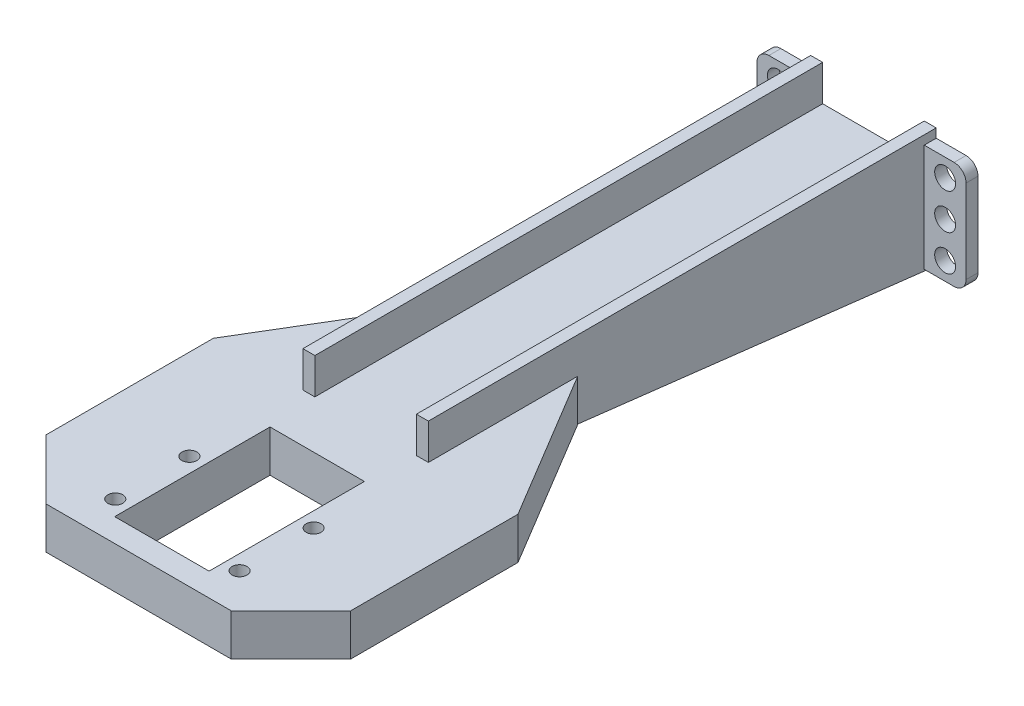
from build123d import *

# Parameters (mm, degrees)
ESQUISSE1_W                  = 35
ESQUISSE1_H                  = 35
BOSS_EXTRU_1_DEPTH           = 2
ESQUISSE2_R                  = 1.75
ESQUISSE2_W                  = 35
ESQUISSE2_H                  = 1.064971157
ENL_V_MAT_EXTRU_1_DEPTH      = 2
BOSS_EXTRU_2_DEPTH           = 280
ESQUISSE5_W                  = 7
ESQUISSE5_H                  = 6
ESQUISSE5_R                  = 1.75
BOSS_EXTRU_3_DEPTH           = 2
ESQUISSE6_R                  = 1.75
BOSS_EXTRU_4_DEPTH           = 2
ESQUISSE10_W                 = 35
ESQUISSE10_H                 = 33.935028843
ESQUISSE10_R                 = 1.75
BOSS_EXTRU_5_DEPTH           = 2
ESQUISSE15_R                 = 6.5
ESQUISSE15_R_2               = 1.75
ENL_V_MAT_EXTRU_2_DEPTH      = 373
CONG_1_R                     = 2
CONG_2_R                     = 4
EXTRU_MINCE1_START           = -2
EXTRU_MINCE1_OUTLINE_W       = 35
EXTRU_MINCE1_OUTLINE_H       = 10
EXTRU_MINCE1_DEPTH           = 2
BOSS_EXTRU_7_DEPTH           = 62.5
BOSS_EXTRU_8_DEPTH           = 160
ENL_V_MAT_EXTRU_4_DEPTH      = 15
BOSS_EXTRU_31_DEPTH          = 69.5
BOSS_EXTRU_31_DEPTH_BACK     = 90.5
ESQUISSE29_W                 = 0.210775501
ESQUISSE29_H                 = 2
BOSS_EXTRU_32_DEPTH          = 160
ENL_V_MAT_EXTRU_7_DEPTH      = 10
ENL_V_MAT_EXTRU_7_DEPTH_BACK = 5
ESQUISSE34_W                 = 144
ESQUISSE34_H                 = 64.710678118
ENL_V_MAT_EXTRU_8_DEPTH      = 2
ESQUISSE35_R                 = 1.5
BOSS_EXTRU_35_DEPTH          = 2
BOSS_EXTRU_36_START          = -2
ESQUISSE36_R                 = 1.5
BOSS_EXTRU_36_DEPTH          = 2
BOSS_EXTRU_37_DEPTH          = 21
BOSS_EXTRU_38_DEPTH          = 28
ESQUISSE42_W                 = 17
ESQUISSE42_H                 = 6
ENL_V_MAT_EXTRU_9_DEPTH      = 124
ESQUISSE43_R                 = 1.1
ENL_V_MAT_EXTRU_11_DEPTH     = 50
ESQUISSE45_R                 = 1.5
ENL_V_MAT_EXTRU_12_DEPTH     = 50
ESQUISSE47_R                 = 1.75
BOSS_EXTRU_40_DEPTH          = 2
ENL_V_MAT_EXTRU_13_DEPTH     = 2
ESQUISSE49_R                 = 1.75
BOSS_EXTRU_41_DEPTH          = 2
ESQUISSE50_W                 = 12.927363302
ESQUISSE50_H                 = 18
ENL_V_MAT_EXTRU_14_DEPTH     = 2
ESQUISSE51_R                 = 1.75
BOSS_EXTRU_42_DEPTH          = 2
BOSS_EXTRU_43_DEPTH          = 2
BOSS_EXTRU_43_DEPTH_BACK     = 2
ESQUISSE53_R                 = 1.75
ENL_V_START                  = -2
ESQUISSE54_R                 = 1.75
ENL_V_MAT_EXTRU_15_DEPTH     = 2
BOSS_EXTRU_44_DEPTH          = 2
BOSS_EXTRU_44_DEPTH_BACK     = 2
ESQUISSE55_R                 = 1.75
ESQUISSE56_R                 = 1.75
ESQUISSE56_R_2               = 6.5
ENL_V_MAT_EXTRU_16_DEPTH     = 305
ESQUISSE57_W                 = 160
ESQUISSE57_H                 = 70.710678119
ENL_V_MAT_EXTRU_17_DEPTH     = 305
BOSS_EXTRU_46_DEPTH          = 2
BOSS_EXTRU_46_DEPTH_BACK     = 5
ESQUISSE60_R                 = 1.1
ESQUISSE61_R                 = 1.25
ENL_V_MAT_EXTRU_18_DEPTH     = 10
BOSS_EXTRU_47_START          = -7
ESQUISSE64_R                 = 1.1
BOSS_EXTRU_47_DEPTH          = 7


# Read off the part's stored shape, not the designer's step: Extru.-Mince1
with BuildPart() as part:
    # Esquisse1 → Boss.-Extru.1 (new body)
    with BuildSketch(Plane(origin=(0, 0, 0), x_dir=(1, 0, 0), z_dir=(0, 1, 0))):
        with Locations((17.5, -17.5)):
            Rectangle(ESQUISSE1_W, ESQUISSE1_H)
    extrude(amount=BOSS_EXTRU_1_DEPTH)

    # Esquisse2 → Enlèv. mat.-Extru.1 (cut)
    with BuildSketch(Plane(origin=(0, 2, 0), x_dir=(1, 0, 0), z_dir=(0, 1, 0))):
        with Locations(Location((30.935029054, -4.064971369, 0), (0, 0, 270))):
            Circle(ESQUISSE2_R)
        with Locations(Location((30.935028843, -30.935028843, 0), (0, 0, 270))):
            Circle(ESQUISSE2_R)
        with Locations(Location((4.064971369, -4.064970946, 0), (0, 0, 270))):
            Circle(ESQUISSE2_R)
        with Locations(Location((4.064971157, -30.935028843, 0), (0, 0, 270))):
            Circle(ESQUISSE2_R)
        with Locations((17.5, -34.467514421)):
            Rectangle(ESQUISSE2_W, ESQUISSE2_H)
    extrude(amount=-ENL_V_MAT_EXTRU_1_DEPTH, mode=Mode.SUBTRACT)

    # Esquisse4 → Boss.-Extru.2 (add)
    with BuildSketch(Plane(origin=(0, 2, 0), x_dir=(1, 0, 0), z_dir=(0, 1, 0))):
        Polygon((17.5, -33.935028843), (7, -33.935028843), (7, -4.064970946), (28, -4.064970946), (28, -33.935028843), align=None)
    extrude(amount=BOSS_EXTRU_2_DEPTH)

    # Esquisse5 → Boss.-Extru.3 (add)
    # profile 1 of 4: a face of its own
    with BuildSketch(Plane.XY.offset(33.935028843)):
        with Locations((31.5, 254)):
            Rectangle(ESQUISSE5_W, ESQUISSE5_H)
        with Locations((31.5, 254)):
            Circle(ESQUISSE5_R, mode=Mode.SUBTRACT)
    # profile 2 of 4: a face of its own
    with BuildSketch(Plane.XY.offset(33.935028843)):
        with Locations((3.5, 254)):
            Rectangle(ESQUISSE5_W, ESQUISSE5_H)
        with Locations((3.5, 254)):
            Circle(ESQUISSE5_R, mode=Mode.SUBTRACT)
    # profile 3 of 4: a face of its own
    with BuildSketch(Plane.XY.offset(33.935028843)):
        with Locations((31.5, 28)):
            Rectangle(ESQUISSE5_W, ESQUISSE5_H)
        with Locations((31.5, 28)):
            Circle(ESQUISSE5_R, mode=Mode.SUBTRACT)
    # profile 4 of 4: a face of its own
    with BuildSketch(Plane.XY.offset(33.935028843)):
        with Locations((3.5, 28)):
            Rectangle(ESQUISSE5_W, ESQUISSE5_H)
        with Locations((3.5, 28)):
            Circle(ESQUISSE5_R, mode=Mode.SUBTRACT)
    extrude(amount=-BOSS_EXTRU_3_DEPTH)

    # Esquisse6 → Boss.-Extru.4 (add)
    # profile 1 of 2: a face of its own
    with BuildSketch(Plane.XY.offset(33.935028843)):
        Polygon((7, 144), (0, 144), (0, 141), (0, 138), (7, 138), (7, 141), align=None)
        with Locations((3.5, 141)):
            Circle(ESQUISSE6_R, mode=Mode.SUBTRACT)
    # profile 2 of 2: a face of its own
    with BuildSketch(Plane.XY.offset(33.935028843)):
        Polygon((35, 144), (28, 144), (28, 141), (28, 138), (35, 138), (35, 141), align=None)
        with Locations((31.5, 141)):
            Circle(ESQUISSE6_R, mode=Mode.SUBTRACT)
    extrude(amount=-BOSS_EXTRU_4_DEPTH)

    # Esquisse10 → Boss.-Extru.5 (add)
    with BuildSketch(Plane(origin=(0, 282, 0), x_dir=(1, 0, 0), z_dir=(0, 1, 0))):
        with Locations((17.5, -16.967514422)):
            Rectangle(ESQUISSE10_W, ESQUISSE10_H)
        with Locations(Location((30.935028843, -30.935028843, 0), (0, 0, 270))):
            Circle(ESQUISSE10_R, mode=Mode.SUBTRACT)
        with Locations(Location((30.935028631, -4.064970946, 0), (0, 0, 270.000013863))):
            Circle(ESQUISSE10_R, mode=Mode.SUBTRACT)
        with Locations(Location((4.064970946, -4.064971369, 0), (0, 0, 270.000013863))):
            Circle(ESQUISSE10_R, mode=Mode.SUBTRACT)
        with Locations(Location((4.064971157, -30.935028843, 0), (0, 0, 270))):
            Circle(ESQUISSE10_R, mode=Mode.SUBTRACT)
    extrude(amount=-BOSS_EXTRU_5_DEPTH)

    # Esquisse15 → Enlèv. mat.-Extru.2 (cut)
    with BuildSketch(Plane(origin=(0, 282, 0), x_dir=(1, 0, 0), z_dir=(0, 1, 0))):
        with Locations(Location((17.5, -17.5, 0), (0, 0, 270))):
            Circle(ESQUISSE15_R)
        with Locations(Location((30.935029054, -4.064971369, 0), (0, 0, 270))):
            Circle(ESQUISSE15_R_2)
    extrude(amount=-ENL_V_MAT_EXTRU_2_DEPTH, mode=Mode.SUBTRACT)

    # Congé1
    cong_1_edges = [part.edges().sort_by_distance(p)[0] for p in [
        (0, 31, 32.935028843),
        (0, 25, 32.935028843),
        (0, 144, 32.935028843),
        (0, 138, 32.935028843),
        (35, 144, 32.935028843),
        (35, 138, 32.935028843),
        (35, 257, 32.935028843),
        (35, 251, 32.935028843),
        (0, 251, 32.935028843),
        (0, 257, 32.935028843),
        (35, 31, 32.935028843),
        (35, 25, 32.935028843),
    ]]
    fillet(cong_1_edges, radius=CONG_1_R)

    # Congé2
    cong_2_edges = [part.edges().sort_by_distance(p)[0] for p in [
        (35, 281, 0),
        (0, 281, 0),
        (0, 1, 0),
        (35, 1, 0),
    ]]
    fillet(cong_2_edges, radius=CONG_2_R)

    # Extru.-Mince1 outline → Extru.-Mince1 (add)
    with BuildSketch(Plane(origin=(0, 282, 0), x_dir=(1, 0, 0), z_dir=(0, 1, 0)).offset(EXTRU_MINCE1_START)):
        with Locations((17.5, -38.935028843)):
            Rectangle(EXTRU_MINCE1_OUTLINE_W, EXTRU_MINCE1_OUTLINE_H)
    extrude(amount=EXTRU_MINCE1_DEPTH)

    # Esquisse20 → Boss.-Extru.7 (add)
    with BuildSketch(Plane.ZY):
        Polygon((43.935028843, 282), (114.645706961, 211.289321881), (110.645706961, 211.289321881), (41.935028843, 280), (34.145804344, 280), (34.145804344, 282), align=None)
    extrude(amount=BOSS_EXTRU_7_DEPTH)

    # Esquisse21 → Boss.-Extru.8 (add)
    with BuildSketch(Plane.ZY.offset(62.5)):
        Polygon((34.145804344, 280), (41.935028843, 280), (110.645706961, 211.289321881), (114.645706961, 211.289321881), (43.935028843, 282), (34.145804344, 282), align=None)
    extrude(amount=-BOSS_EXTRU_8_DEPTH)

    # Esquisse22 → Enlèv. mat.-Extru.4 (cut)
    with BuildSketch(Plane(origin=(0, 162.967514421, 162.967514421), x_dir=(1, 0, 0), z_dir=(0, 0.7071067811865462, 0.7071067811865488))):
        Polygon((-42.064466094, 147.626821562), (-45.6, 147.626821562), (-45.6, 89.047889374), (-42.064466094, 89.047889374), (-42.064466094, 85.512355468), (77.064466094, 85.512355468), (77.064466094, 89.047889374), (80.6, 89.047889374), (80.6, 147.626821562), (77.064466094, 147.626821562), (77.064466094, 151.162355468), (-42.064466094, 151.162355468), align=None)
    extrude(amount=-ENL_V_MAT_EXTRU_4_DEPTH, mode=Mode.SUBTRACT)

    # Esquisse29 → Boss.-Extru.31 (add, two sides: drawn at the far end of the back side and taken through both)
    with BuildSketch(Plane.ZY.offset(-7).offset(-BOSS_EXTRU_31_DEPTH_BACK)):
        with Locations((34.040416594, 281)):
            Rectangle(ESQUISSE29_W, ESQUISSE29_H)
    extrude(amount=BOSS_EXTRU_31_DEPTH + BOSS_EXTRU_31_DEPTH_BACK)

    # Esquisse32 → Boss.-Extru.32 (add)
    with BuildSketch(Plane.ZY.offset(62.5)):
        Polygon((110.645706961, 211.289321881), (33.935028843, 211.289321881), (33.935028843, 280), (35.935028843, 280), (35.935028843, 213.289321881), (108.645706961, 213.289321881), align=None)
    extrude(amount=-BOSS_EXTRU_32_DEPTH)

    # Esquisse33 → Enlèv. mat.-Extru.7 (cut, two sides: drawn at the far end of the back side and taken through both)
    with BuildSketch(Plane(origin=(0, 0, 33.935028843), x_dir=(-1, 0, 0), z_dir=(0, 0, -1)).offset(-ENL_V_MAT_EXTRU_7_DEPTH_BACK)):
        Polygon((-28, 274.000000001), (-89.5, 274.000000001), (-89.5, 219.289321881), (-81.5, 219.289321881), (-28, 219.289321881), align=None)
        with BuildLine():
            Line((54.5, 274.000000001), (-7, 274.000000001))
            Line((-7, 274.000000001), (-7, 257))
            Line((-7, 257), (-2, 257))
            ThreePointArc((-2, 257), (-0.585786438, 256.414213562), (0, 255))
            Line((0, 255), (0, 253))
            ThreePointArc((0, 253), (-0.585786438, 251.585786438), (-2, 251))
            Line((-2, 251), (-7, 251))
            Line((-7, 251), (-7, 219.289321881))
            Line((-7, 219.289321881), (1, 219.289321881))
            Line((1, 219.289321881), (54.5, 219.289321881))
            Line((54.5, 219.289321881), (54.5, 274.000000001))
        make_face()
        with BuildLine():
            Line((-2, 257), (-7, 257))
            Line((-7, 257), (-7, 251))
            Line((-7, 251), (-2, 251))
            ThreePointArc((-2, 251), (-0.585786438, 251.585786438), (0, 253))
            Line((0, 253), (0, 255))
            ThreePointArc((0, 255), (-0.585786438, 256.414213562), (-2, 257))
        make_face()
    extrude(amount=ENL_V_MAT_EXTRU_7_DEPTH + ENL_V_MAT_EXTRU_7_DEPTH_BACK, mode=Mode.SUBTRACT)

    # Esquisse34 → Enlèv. mat.-Extru.8 (cut)
    with BuildSketch(Plane.XZ.offset(-211.289321881)):
        with Locations((17.5, 74.290367902)):
            Rectangle(ESQUISSE34_W, ESQUISSE34_H)
    extrude(amount=-ENL_V_MAT_EXTRU_8_DEPTH, mode=Mode.SUBTRACT)

    # Esquisse35 → Boss.-Extru.35 (add)
    with BuildSketch(Plane(origin=(97.5, 0, 0), x_dir=(0, 0, -1), z_dir=(1, 0, 0))):
        Polygon((-35.935028843, 280), (-35.935028843, 274.000000001), (-35.935028843, 213.289321881), (-108.645706961, 213.289321881), (-102.645706961, 219.289321881), (-41.935028842, 219.289321881), (-41.935028842, 274.000000001), (-47.935028841, 274.000000001), (-41.935028843, 280), align=None)
        with Locations((-38.935028842, 216.289321881)):
            Circle(ESQUISSE35_R, mode=Mode.SUBTRACT)
        with Locations((-38.935028842, 277.000000001)):
            Circle(ESQUISSE35_R, mode=Mode.SUBTRACT)
        with Locations((-99.645706961, 216.289321881)):
            Circle(ESQUISSE35_R, mode=Mode.SUBTRACT)
    extrude(amount=-BOSS_EXTRU_35_DEPTH)

    # Esquisse36 → Boss.-Extru.36 (add)
    with BuildSketch(Plane.ZY.offset(62.5).offset(BOSS_EXTRU_36_START)):
        Polygon((35.935028843, 213.289321881), (108.645706961, 213.289321881), (102.645706961, 219.289321881), (41.935028842, 219.289321881), (41.935028842, 274.000000001), (47.935028841, 274.000000001), (41.935028843, 280), (35.935028843, 280), (35.935028843, 274.000000001), align=None)
        with Locations(Location((99.645706961, 216.289321881, 0), (0, 0, 180))):
            Circle(ESQUISSE36_R, mode=Mode.SUBTRACT)
        with Locations(Location((38.935028842, 277.000000001, 0), (0, 0, 180))):
            Circle(ESQUISSE36_R, mode=Mode.SUBTRACT)
        with Locations(Location((38.935028842, 216.289321881, 0), (0, 0, 180))):
            Circle(ESQUISSE36_R, mode=Mode.SUBTRACT)
    extrude(amount=BOSS_EXTRU_36_DEPTH)

    # Esquisse39 → Boss.-Extru.37 (add)
    with BuildSketch(Plane(origin=(28, 0, 0), x_dir=(0, 0, -1), z_dir=(1, 0, 0))):
        Polygon((-33.935028843, 211.289321881), (-33.935028843, 191.289321881), (-118.935028843, 201.289321881), (-118.935028843, 211.289321881), align=None)
    extrude(amount=-BOSS_EXTRU_37_DEPTH)

    # Esquisse40 → Boss.-Extru.38 (add)
    with BuildSketch(Plane.XY.offset(118.935028843)):
        Polygon((7, 201.289321881), (2, 201.289321881), (2, 203.289321881), (33, 203.289321881), (33, 201.289321881), (28, 201.289321881), align=None)
    extrude(amount=BOSS_EXTRU_38_DEPTH)

    # Esquisse42 → Enlèv. mat.-Extru.9 (cut)
    with BuildSketch(Plane.XY.offset(118.935028843)):
        with Locations((17.5, 208.289321881)):
            Rectangle(ESQUISSE42_W, ESQUISSE42_H)
    extrude(amount=-ENL_V_MAT_EXTRU_9_DEPTH, mode=Mode.SUBTRACT)

    # Esquisse43 → Enlèv. mat.-Extru.11 (cut)
    with BuildSketch(Plane(origin=(0, 203.289321881, 0), x_dir=(1, 0, 0), z_dir=(0, 1, 0))):
        with Locations(Location((5, -144.935028843, 0), (0, 0, 270))):
            Circle(ESQUISSE43_R)
        with Locations(Location((30, -144.935028843, 0), (0, 0, 270))):
            Circle(ESQUISSE43_R)
        with Locations(Location((5, -130.435028843, 0), (0, 0, 270))):
            Circle(ESQUISSE43_R)
        with Locations(Location((30, -130.435028843, 0), (0, 0, 270))):
            Circle(ESQUISSE43_R)
        with BuildLine():
            Line((5, -123.319506434), (5, -128.435028843))
            ThreePointArc((5, -128.435028843), (7, -130.435028843), (5, -132.435028843))
            Line((5, -132.435028843), (5, -142.935028843))
            ThreePointArc((5, -142.935028843), (6.414213562, -143.52081528), (7, -144.935028843))
            Line((7, -144.935028843), (28, -144.935028843))
            ThreePointArc((28, -144.935028843), (28.585786438, -143.52081528), (30, -142.935028843))
            Line((30, -142.935028843), (30, -132.435028843))
            ThreePointArc((30, -132.435028843), (28, -130.435028843), (30, -128.435028843))
            Line((30, -128.435028843), (30, -123.319506434))
            Line((30, -123.319506434), (5, -123.319506434))
        make_face()
    extrude(amount=-ENL_V_MAT_EXTRU_11_DEPTH, mode=Mode.SUBTRACT)

    # Esquisse45 → Enlèv. mat.-Extru.12 (cut)
    with BuildSketch(Plane(origin=(0, 162.967514421, 162.967514421), x_dir=(1, 0, 0), z_dir=(0, 0.7071067811865462, 0.7071067811865488))):
        with Locations(Location((80.6, 151.162355468, 0), (0, 0, 270))):
            Circle(ESQUISSE45_R)
        with Locations(Location((80.6, 85.512355468, 0), (0, 0, 270))):
            Circle(ESQUISSE45_R)
        with Locations(Location((-45.6, 85.512355468, 0), (0, 0, 270))):
            Circle(ESQUISSE45_R)
        with Locations(Location((-45.6, 151.162355468, 0), (0, 0, 270))):
            Circle(ESQUISSE45_R)
    extrude(amount=-ENL_V_MAT_EXTRU_12_DEPTH, mode=Mode.SUBTRACT)

    # Esquisse47 → Boss.-Extru.40 (add)
    # profile 1 of 4: a face of its own
    with BuildSketch(Plane.XY.offset(33.935028843)):
        with BuildLine():
            Line((2, 144), (7, 144))
            Line((7, 144), (7, 150))
            Line((7, 150), (2, 150))
            ThreePointArc((2, 150), (0.585786438, 149.414213562), (0, 148))
            Line((0, 148), (0, 146))
            ThreePointArc((0, 146), (0.585786438, 144.585786438), (2, 144))
        make_face()
        with Locations((3.5, 147)):
            Circle(ESQUISSE47_R, mode=Mode.SUBTRACT)
    # profile 2 of 4: a face of its own
    with BuildSketch(Plane.XY.offset(33.935028843)):
        with BuildLine():
            Line((28, 150), (28, 144))
            Line((28, 144), (33, 144))
            ThreePointArc((33, 144), (34.414213562, 144.585786438), (35, 146))
            Line((35, 146), (35, 148))
            ThreePointArc((35, 148), (34.414213562, 149.414213562), (33, 150))
            Line((33, 150), (28, 150))
        make_face()
        with Locations((31.5, 147)):
            Circle(ESQUISSE47_R, mode=Mode.SUBTRACT)
    # profile 3 of 4: a face of its own
    with BuildSketch(Plane.XY.offset(33.935028843)):
        with BuildLine():
            Line((35, 134), (35, 136))
            ThreePointArc((35, 136), (34.414213562, 137.414213562), (33, 138))
            Line((33, 138), (28, 138))
            Line((28, 138), (28, 132))
            Line((28, 132), (33, 132))
            ThreePointArc((33, 132), (34.414213562, 132.585786438), (35, 134))
        make_face()
        with Locations((31.5, 135)):
            Circle(ESQUISSE47_R, mode=Mode.SUBTRACT)
    # profile 4 of 4: a face of its own
    with BuildSketch(Plane.XY.offset(33.935028843)):
        with BuildLine():
            Line((7, 138), (2, 138))
            ThreePointArc((2, 138), (0.585786438, 137.414213562), (0, 136))
            Line((0, 136), (0, 134))
            ThreePointArc((0, 134), (0.585786438, 132.585786438), (2, 132))
            Line((2, 132), (7, 132))
            Line((7, 132), (7, 138))
        make_face()
        with Locations((3.5, 135)):
            Circle(ESQUISSE47_R, mode=Mode.SUBTRACT)
    extrude(amount=-BOSS_EXTRU_40_DEPTH)

    # Esquisse48 → Enlèv. mat.-Extru.13 (cut)
    with BuildSketch(Plane.XY.offset(33.935028843)):
        Polygon((-4.556540033, 144), (-4.556540033, 138), (2, 138), (7, 138), (7, 144), (2, 144), align=None)
        Polygon((33.295178048, 144), (39.851718081, 144), (39.851718081, 138), (33.295178048, 138), (28.295178048, 138), (28.295178048, 144), align=None)
    extrude(amount=-ENL_V_MAT_EXTRU_13_DEPTH, mode=Mode.SUBTRACT)

    # Esquisse49 → Boss.-Extru.41 (add)
    # profile 1 of 2: a face of its own
    with BuildSketch(Plane.XY.offset(33.935028843)):
        with BuildLine():
            Line((2, 180.289321881), (7, 180.289321881))
            Line((7, 180.289321881), (7, 186.289321881))
            Line((7, 186.289321881), (2, 186.289321881))
            ThreePointArc((2, 186.289321881), (0.585786438, 185.703535444), (0, 184.289321881))
            Line((0, 184.289321881), (0, 182.289321881))
            ThreePointArc((0, 182.289321881), (0.585786438, 180.875108319), (2, 180.289321881))
        make_face()
        with Locations((3.5, 183.289321881)):
            Circle(ESQUISSE49_R, mode=Mode.SUBTRACT)
    # profile 2 of 2: a face of its own
    with BuildSketch(Plane.XY.offset(33.935028843)):
        with BuildLine():
            Line((35, 182.289321881), (35, 184.289321881))
            ThreePointArc((35, 184.289321881), (34.414213562, 185.703535444), (33, 186.289321881))
            Line((33, 186.289321881), (28, 186.289321881))
            Line((28, 186.289321881), (28, 180.289321881))
            Line((28, 180.289321881), (33, 180.289321881))
            ThreePointArc((33, 180.289321881), (34.414213562, 180.875108319), (35, 182.289321881))
        make_face()
        with Locations((31.5, 183.289321881)):
            Circle(ESQUISSE49_R, mode=Mode.SUBTRACT)
    extrude(amount=-BOSS_EXTRU_41_DEPTH)

    # Esquisse50 → Enlèv. mat.-Extru.14 (cut)
    with BuildSketch(Plane.XY.offset(33.935028843)):
        with Locations((34.463681651, 141)):
            Rectangle(ESQUISSE50_W, ESQUISSE50_H)
    extrude(amount=-ENL_V_MAT_EXTRU_14_DEPTH, mode=Mode.SUBTRACT)

    # Esquisse51 → Boss.-Extru.42 (add)
    # profile 1 of 3: a face of its own
    with BuildSketch(Plane.XY.offset(33.935028843)):
        with BuildLine():
            Line((7, 150), (7, 144))
            Line((7, 144), (2, 144))
            ThreePointArc((2, 144), (0.585786438, 144.585786438), (0, 146))
            Line((0, 146), (0, 148))
            ThreePointArc((0, 148), (0.585786438, 149.414213562), (2, 150))
            Line((2, 150), (7, 150))
        make_face()
        with Locations((3.5, 147)):
            Circle(ESQUISSE51_R, mode=Mode.SUBTRACT)
    # profile 2 of 3: a face of its own
    with BuildSketch(Plane.XY.offset(33.935028843)):
        with BuildLine():
            Line((33, 138.018442997), (28, 138.018442997))
            Line((28, 138.018442997), (28, 132.018442997))
            Line((28, 132.018442997), (33, 132.018442997))
            ThreePointArc((33, 132.018442997), (34.414213562, 132.604229434), (35, 134.018442997))
            Line((35, 134.018442997), (35, 136.018442997))
            ThreePointArc((35, 136.018442997), (34.414213562, 137.432656559), (33, 138.018442997))
        make_face()
        with Locations((31.5, 135.018442997)):
            Circle(ESQUISSE51_R, mode=Mode.SUBTRACT)
    # profile 3 of 3: a face of its own
    with BuildSketch(Plane.XY.offset(33.935028843)):
        with BuildLine():
            Line((33, 150), (28, 150))
            Line((28, 150), (28, 144))
            Line((28, 144), (33, 144))
            ThreePointArc((33, 144), (34.414213562, 144.585786438), (35, 146))
            Line((35, 146), (35, 148))
            ThreePointArc((35, 148), (34.414213562, 149.414213562), (33, 150))
        make_face()
        with Locations((31.5, 147)):
            Circle(ESQUISSE51_R, mode=Mode.SUBTRACT)
    extrude(amount=-BOSS_EXTRU_42_DEPTH)

    # Esquisse53 → Boss.-Extru.43 (add, two sides: drawn at the far end of the back side and taken through both)
    # profile 1 of 4: a face of its own
    with BuildSketch(Plane(origin=(0, 0, 33.935028843), x_dir=(-1, 0, 0), z_dir=(0, 0, -1)).offset(-BOSS_EXTRU_43_DEPTH_BACK)):
        with BuildLine():
            Line((0, 275.000000001), (0, 273.000000001))
            ThreePointArc((0, 273.000000001), (-0.585786438, 271.585786439), (-2, 271.000000001))
            Line((-2, 271.000000001), (-7, 271.000000001))
            Line((-7, 271.000000001), (-7, 277.000000001))
            Line((-7, 277.000000001), (-2, 277.000000001))
            ThreePointArc((-2, 277.000000001), (-0.585786438, 276.414213564), (0, 275.000000001))
        make_face()
        with Locations(Location((-3.5, 274.000000001, 0), (0, 0, 180))):
            Circle(ESQUISSE53_R, mode=Mode.SUBTRACT)
    # profile 2 of 4: a face of its own
    with BuildSketch(Plane(origin=(0, 0, 33.935028843), x_dir=(-1, 0, 0), z_dir=(0, 0, -1)).offset(-BOSS_EXTRU_43_DEPTH_BACK)):
        with BuildLine():
            Line((-28, 222.289321881), (-28, 216.289321881))
            Line((-28, 216.289321881), (-33, 216.289321881))
            ThreePointArc((-33, 216.289321881), (-34.414213562, 216.875108319), (-35, 218.289321881))
            Line((-35, 218.289321881), (-35, 220.289321881))
            ThreePointArc((-35, 220.289321881), (-34.414213562, 221.703535444), (-33, 222.289321881))
            Line((-33, 222.289321881), (-28, 222.289321881))
        make_face()
        with Locations((-31.5, 219.289321881)):
            Circle(ESQUISSE53_R, mode=Mode.SUBTRACT)
    # profile 3 of 4: a face of its own
    with BuildSketch(Plane(origin=(0, 0, 33.935028843), x_dir=(-1, 0, 0), z_dir=(0, 0, -1)).offset(-BOSS_EXTRU_43_DEPTH_BACK)):
        with BuildLine():
            Line((-28, 277.000000001), (-28, 271.000000001))
            Line((-28, 271.000000001), (-33, 271.000000001))
            ThreePointArc((-33, 271.000000001), (-34.414213562, 271.585786439), (-35, 273.000000001))
            Line((-35, 273.000000001), (-35, 275.000000001))
            ThreePointArc((-35, 275.000000001), (-34.414213562, 276.414213564), (-33, 277.000000001))
            Line((-33, 277.000000001), (-28, 277.000000001))
        make_face()
        with Locations((-31.5, 274.000000001)):
            Circle(ESQUISSE53_R, mode=Mode.SUBTRACT)
    # profile 4 of 4: a face of its own
    with BuildSketch(Plane(origin=(0, 0, 33.935028843), x_dir=(-1, 0, 0), z_dir=(0, 0, -1)).offset(-BOSS_EXTRU_43_DEPTH_BACK)):
        with BuildLine():
            Line((0, 220.289321881), (0, 218.289321881))
            ThreePointArc((0, 218.289321881), (-0.585786438, 216.875108319), (-2, 216.289321881))
            Line((-2, 216.289321881), (-7, 216.289321881))
            Line((-7, 216.289321881), (-7, 222.289321881))
            Line((-7, 222.289321881), (-2, 222.289321881))
            ThreePointArc((-2, 222.289321881), (-0.585786438, 221.703535444), (0, 220.289321881))
        make_face()
        with Locations(Location((-3.5, 219.289321881, 0), (0, 0, 180))):
            Circle(ESQUISSE53_R, mode=Mode.SUBTRACT)
    extrude(amount=BOSS_EXTRU_43_DEPTH + BOSS_EXTRU_43_DEPTH_BACK)

    # Esquisse54 → Enlèv. mat.-Extru.15 (cut)
    with BuildSketch(Plane(origin=(0, 0, 33.935028843), x_dir=(-1, 0, 0), z_dir=(0, 0, -1)).offset(ENL_V_START)):
        with Locations((-31.5, 274.000000001)):
            Circle(ESQUISSE54_R)
        with Locations(Location((-3.5, 274.000000001, 0), (0, 0, 180))):
            Circle(ESQUISSE54_R)
        with Locations((-31.5, 219.289321881)):
            Circle(ESQUISSE54_R)
        with Locations(Location((-3.5, 219.289321881, 0), (0, 0, 180))):
            Circle(ESQUISSE54_R)
    extrude(amount=ENL_V_MAT_EXTRU_15_DEPTH, mode=Mode.SUBTRACT)

    # Esquisse55 → Boss.-Extru.44 (add, two sides: drawn at the far end of the back side and taken through both)
    # profile 1 of 2: a face of its own
    with BuildSketch(Plane(origin=(0, 0, 33.935028843), x_dir=(-1, 0, 0), z_dir=(0, 0, -1)).offset(-BOSS_EXTRU_44_DEPTH_BACK)):
        with BuildLine():
            Line((0, 207.789321881), (0, 205.789321881))
            Line((0, 205.789321881), (0, 201.789321881))
            Line((0, 201.789321881), (0, 199.789321881))
            Line((0, 199.789321881), (0, 195.789321881))
            Line((0, 195.789321881), (0, 193.789321881))
            ThreePointArc((0, 193.789321881), (-0.585786438, 192.375108319), (-2, 191.789321881))
            Line((-2, 191.789321881), (-7, 191.789321881))
            Line((-7, 191.789321881), (-7, 197.789321881))
            Line((-7, 197.789321881), (-7, 203.789321881))
            Line((-7, 203.789321881), (-7, 209.789321881))
            Line((-7, 209.789321881), (-2, 209.789321881))
            ThreePointArc((-2, 209.789321881), (-0.585786438, 209.203535444), (0, 207.789321881))
        make_face()
        with Locations((-3.5, 206.789321881)):
            Circle(ESQUISSE55_R, mode=Mode.SUBTRACT)
        with Locations((-3.5, 194.789321881)):
            Circle(ESQUISSE55_R, mode=Mode.SUBTRACT)
        with Locations((-3.5, 200.789321881)):
            Circle(ESQUISSE55_R, mode=Mode.SUBTRACT)
    # profile 2 of 2: a face of its own
    with BuildSketch(Plane(origin=(0, 0, 33.935028843), x_dir=(-1, 0, 0), z_dir=(0, 0, -1)).offset(-BOSS_EXTRU_44_DEPTH_BACK)):
        with BuildLine():
            Line((-35, 195.789321881), (-35, 193.789321881))
            ThreePointArc((-35, 193.789321881), (-34.414213562, 192.375108319), (-33, 191.789321881))
            Line((-33, 191.789321881), (-28, 191.789321881))
            Line((-28, 191.789321881), (-28, 197.789321881))
            Line((-28, 197.789321881), (-28, 203.789321881))
            Line((-28, 203.789321881), (-28, 209.789321881))
            Line((-28, 209.789321881), (-33, 209.789321881))
            ThreePointArc((-33, 209.789321881), (-34.414213562, 209.203535444), (-35, 207.789321881))
            Line((-35, 207.789321881), (-35, 205.789321881))
            Line((-35, 205.789321881), (-35, 201.789321881))
            Line((-35, 201.789321881), (-35, 199.789321881))
            Line((-35, 199.789321881), (-35, 195.789321881))
        make_face()
        with Locations((-31.5, 194.789321881)):
            Circle(ESQUISSE55_R, mode=Mode.SUBTRACT)
        with Locations((-31.5, 206.789321881)):
            Circle(ESQUISSE55_R, mode=Mode.SUBTRACT)
        with Locations((-31.5, 200.789321881)):
            Circle(ESQUISSE55_R, mode=Mode.SUBTRACT)
    extrude(amount=BOSS_EXTRU_44_DEPTH + BOSS_EXTRU_44_DEPTH_BACK)

    # Esquisse56 → Enlèv. mat.-Extru.16 (cut)
    # profile 1 of 7: a face of its own
    with BuildSketch(Plane(origin=(0, 282, 0), x_dir=(1, 0, 0), z_dir=(0, 1, 0))):
        with BuildLine():
            Line((-62.5, -33.935028843), (0, -33.935028843))
            Line((0, -33.935028843), (0, -4))
            ThreePointArc((0, -4), (1.171572875, -1.171572875), (4, 0))
            Line((4, 0), (31, 0))
            ThreePointArc((31, 0), (33.828427125, -1.171572875), (35, -4))
            Line((35, -4), (35, -33.935028843))
            Line((35, -33.935028843), (97.5, -33.935028843))
            Line((97.5, -33.935028843), (137.880494562, -33.935028843))
            Line((137.880494562, -33.935028843), (137.880494562, 14.445563897))
            Line((137.880494562, 14.445563897), (-77.143975035, 14.445563897))
            Line((-77.143975035, 14.445563897), (-77.143975035, -33.935028843))
            Line((-77.143975035, -33.935028843), (-62.5, -33.935028843))
        make_face()
    # profile 2 of 7: a face of its own
    with BuildSketch(Plane(origin=(0, 282, 0), x_dir=(1, 0, 0), z_dir=(0, 1, 0))):
        with BuildLine():
            Line((0, -33.935028843), (1, -33.935028843))
            Line((1, -33.935028843), (35, -33.935028843))
            Line((35, -33.935028843), (35, -4))
            ThreePointArc((35, -4), (33.828427125, -1.171572875), (31, 0))
            Line((31, 0), (4, 0))
            ThreePointArc((4, 0), (1.171572875, -1.171572875), (0, -4))
            Line((0, -4), (0, -33.935028843))
        make_face()
        with Locations((4.064971157, -30.935028843)):
            Circle(ESQUISSE56_R, mode=Mode.SUBTRACT)
        with Locations((17.5, -17.5)):
            Circle(ESQUISSE56_R_2, mode=Mode.SUBTRACT)
        with Locations((30.935028843, -30.935028843)):
            Circle(ESQUISSE56_R, mode=Mode.SUBTRACT)
        with Locations((4.064970946, -4.064971369)):
            Circle(ESQUISSE56_R, mode=Mode.SUBTRACT)
        with Locations((30.935028631, -4.064970946)):
            Circle(ESQUISSE56_R, mode=Mode.SUBTRACT)
    # profile 3 of 7: a face of its own
    with BuildSketch(Plane(origin=(0, 282, 0), x_dir=(1, 0, 0), z_dir=(0, 1, 0))):
        with Locations((4.064970946, -4.064971369)):
            Circle(ESQUISSE56_R)
    # profile 4 of 7: a face of its own
    with BuildSketch(Plane(origin=(0, 282, 0), x_dir=(1, 0, 0), z_dir=(0, 1, 0))):
        with Locations((4.064971157, -30.935028843)):
            Circle(ESQUISSE56_R)
    # profile 5 of 7: a face of its own
    with BuildSketch(Plane(origin=(0, 282, 0), x_dir=(1, 0, 0), z_dir=(0, 1, 0))):
        with Locations((30.935028843, -30.935028843)):
            Circle(ESQUISSE56_R)
    # profile 6 of 7: a face of its own
    with BuildSketch(Plane(origin=(0, 282, 0), x_dir=(1, 0, 0), z_dir=(0, 1, 0))):
        with Locations((30.935028631, -4.064970946)):
            Circle(ESQUISSE56_R)
    # profile 7 of 7: a face of its own
    with BuildSketch(Plane(origin=(0, 282, 0), x_dir=(1, 0, 0), z_dir=(0, 1, 0))):
        with Locations((17.5, -17.5)):
            Circle(ESQUISSE56_R_2)
    extrude(amount=-ENL_V_MAT_EXTRU_16_DEPTH, mode=Mode.SUBTRACT)

    # Esquisse57 → Enlèv. mat.-Extru.17 (cut)
    with BuildSketch(Plane(origin=(0, 0, 33.935028843), x_dir=(-1, 0, 0), z_dir=(0, 0, -1))):
        with Locations((-17.5, 246.64466094)):
            Rectangle(ESQUISSE57_W, ESQUISSE57_H)
    extrude(amount=-ENL_V_MAT_EXTRU_17_DEPTH, mode=Mode.SUBTRACT)

    # Esquisse60 → Boss.-Extru.46 (add, two sides: drawn at the far end of the back side and taken through both)
    # profile 1 of 3: a face of its own
    with BuildSketch(Plane(origin=(0, 203.289321881, 0), x_dir=(1, 0, 0), z_dir=(0, 1, 0)).offset(-BOSS_EXTRU_46_DEPTH_BACK)):
        Polygon((28, -93.935028843), (17.5, -93.935028843), (7, -93.935028843), (-8, -118.935028843), (-8, -146.935028843), (2, -156.935028843), (33, -156.935028843), (43, -146.935028843), (43, -118.935028843), align=None)
        Polygon((28, -118.935028843), (33, -118.935028843), (33, -146.935028843), (2, -146.935028843), (2, -118.935028843), (7, -118.935028843), align=None, mode=Mode.SUBTRACT)
    # profile 2 of 3: a face of its own
    with BuildSketch(Plane(origin=(0, 203.289321881, 0), x_dir=(1, 0, 0), z_dir=(0, 1, 0)).offset(-BOSS_EXTRU_46_DEPTH_BACK)):
        Polygon((33, -146.935028843), (33, -118.935028843), (28, -118.935028843), (7, -118.935028843), (2, -118.935028843), (2, -146.935028843), align=None)
        with Locations(Location((5, -130.435028843, 0), (0, 0, 270))):
            Circle(ESQUISSE60_R, mode=Mode.SUBTRACT)
        with Locations(Location((5, -144.935028843, 0), (0, 0, 270))):
            Circle(ESQUISSE60_R, mode=Mode.SUBTRACT)
        with Locations(Location((30, -130.435028843, 0), (0, 0, 270))):
            Circle(ESQUISSE60_R, mode=Mode.SUBTRACT)
        with Locations(Location((30, -144.935028843, 0), (0, 0, 270))):
            Circle(ESQUISSE60_R, mode=Mode.SUBTRACT)
        with BuildLine():
            ThreePointArc((7, -144.935028843), (6.414213562, -143.52081528), (5, -142.935028843))
            Line((5, -142.935028843), (5, -132.435028843))
            ThreePointArc((5, -132.435028843), (7, -130.435028843), (5, -128.435028843))
            Line((5, -128.435028843), (5, -123.319506434))
            Line((5, -123.319506434), (30, -123.319506434))
            Line((30, -123.319506434), (30, -128.435028843))
            ThreePointArc((30, -128.435028843), (28, -130.435028843), (30, -132.435028843))
            Line((30, -132.435028843), (30, -142.935028843))
            ThreePointArc((30, -142.935028843), (28.585786438, -143.52081528), (28, -144.935028843))
            Line((28, -144.935028843), (7, -144.935028843))
        make_face(mode=Mode.SUBTRACT)
    # profile 3 of 3: a face of its own
    with BuildSketch(Plane(origin=(0, 203.289321881, 0), x_dir=(1, 0, 0), z_dir=(0, 1, 0)).offset(-BOSS_EXTRU_46_DEPTH_BACK)):
        with BuildLine():
            Line((5, -142.935028843), (5, -132.435028843))
            ThreePointArc((5, -132.435028843), (7, -130.435028843), (5, -128.435028843))
            Line((5, -128.435028843), (5, -123.319506434))
            Line((5, -123.319506434), (30, -123.319506434))
            Line((30, -123.319506434), (30, -128.435028843))
            ThreePointArc((30, -128.435028843), (28, -130.435028843), (30, -132.435028843))
            Line((30, -132.435028843), (30, -142.935028843))
            ThreePointArc((30, -142.935028843), (28.585786438, -143.52081528), (28, -144.935028843))
            Line((28, -144.935028843), (7, -144.935028843))
            ThreePointArc((7, -144.935028843), (6.414213562, -143.52081528), (5, -142.935028843))
        make_face()
    extrude(amount=BOSS_EXTRU_46_DEPTH + BOSS_EXTRU_46_DEPTH_BACK)

    # Esquisse61 → Enlèv. mat.-Extru.18 (cut)
    with BuildSketch(Plane(origin=(0, 205.289321881, 0), x_dir=(1, 0, 0), z_dir=(0, 1, 0))):
        with Locations(Location((7.1, -150.438978733, 0), (0, 0, 270))):
            Circle(ESQUISSE61_R)
        with Locations(Location((27.9, -150.438978733, 0), (0, 0, 270))):
            Circle(ESQUISSE61_R)
        with Locations(Location((7.1, -138.038978733, 0), (0, 0, 270))):
            Circle(ESQUISSE61_R)
        with Locations(Location((27.9, -138.038978733, 0), (0, 0, 270))):
            Circle(ESQUISSE61_R)
        Polygon((9.6, -138.038978733), (9.6, -153.038978733), (25.4, -153.038978733), (25.4, -138.038978733), (25.4, -127.038978733), (9.6, -127.038978733), align=None)
    extrude(amount=-ENL_V_MAT_EXTRU_18_DEPTH, mode=Mode.SUBTRACT)

    # Esquisse64 → Boss.-Extru.47 (add)
    with BuildSketch(Plane(origin=(0, 205.289321881, 0), x_dir=(1, 0, 0), z_dir=(0, 1, 0)).offset(BOSS_EXTRU_47_START)):
        with Locations((5, -130.435028843)):
            Circle(ESQUISSE64_R)
        with Locations((5, -144.935028843)):
            Circle(ESQUISSE64_R)
        with Locations((30, -144.935028843)):
            Circle(ESQUISSE64_R)
        with Locations((30, -130.435028843)):
            Circle(ESQUISSE64_R)
    extrude(amount=BOSS_EXTRU_47_DEPTH)


solid = part.part
